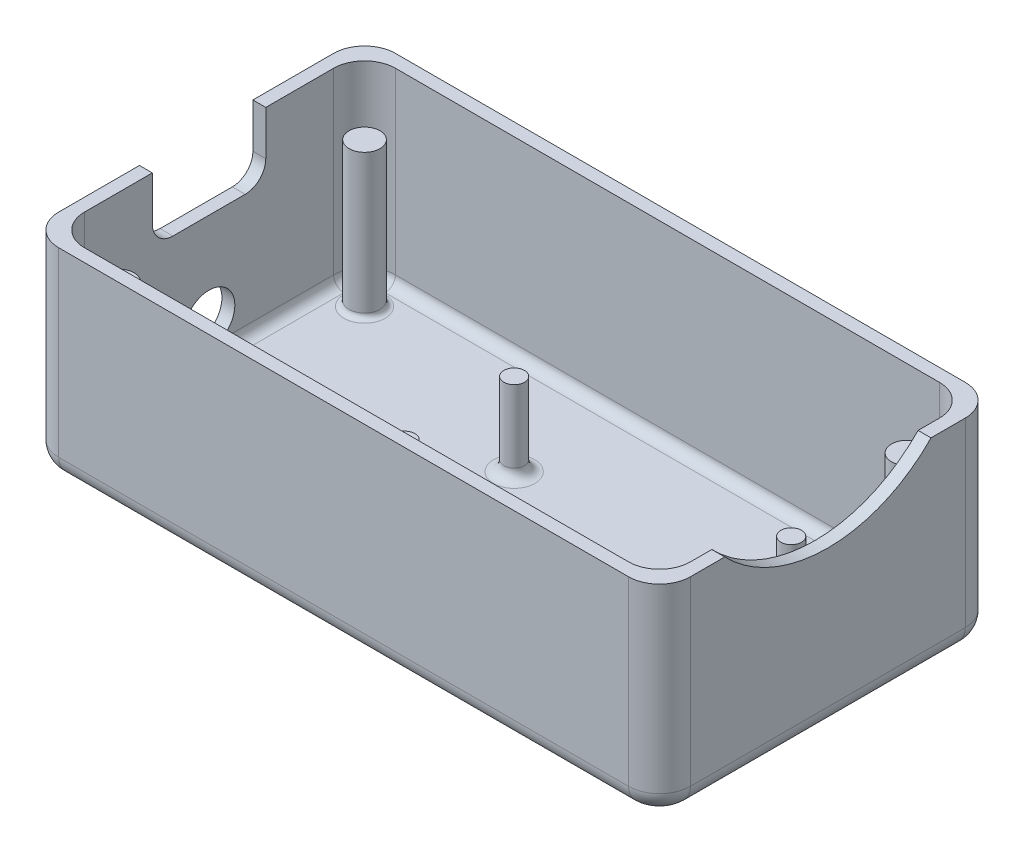
from build123d import *

# Parameters (mm, degrees)
BOSS_EXTRUDE2_DEPTH = 19.6
SKETCH3_W           = 58.75
SKETCH3_H           = 30.15
BOSS_EXTRUDE3_DEPTH = 1.25
SKETCH5_R           = 1.5
BOSS_EXTRUDE4_DEPTH = 14
FILLET1_R           = 0.5
SKETCH6_R           = 1
BOSS_EXTRUDE6_DEPTH = 8
FILLET3_R           = 1
FILLET4_R           = 2
SKETCH7_R           = 2.5
SKETCH7_W           = 11
SKETCH7_H           = 6.3
CUT_EXTRUDE1_DEPTH  = 2
FILLET7_R           = 1
CUT_EXTRUDE2_DEPTH  = 2
FILLET8_R           = 2


with BuildPart() as part:
    # Sketch2 → Boss-Extrude2 (new body)
    with BuildSketch(Plane(origin=(0, 0, 0), x_dir=(1, 0, 0), z_dir=(0, 1, 0))):
        with BuildLine():
            Line((-54.15, 1.25), (1.1, 1.25))
            ThreePointArc((1.1, 1.25), (3.221320344, 0.371320344), (4.1, -1.75))
            Line((4.1, -1.75), (4.1, -28.4))
            ThreePointArc((4.1, -28.4), (3.221320344, -30.521320344), (1.1, -31.4))
            Line((1.1, -31.4), (-54.15, -31.4))
            ThreePointArc((-54.15, -31.4), (-56.271320344, -30.521320344), (-57.15, -28.4))
            Line((-57.15, -28.4), (-57.15, -1.75))
            ThreePointArc((-57.15, -1.75), (-56.271320344, 0.371320344), (-54.15, 1.25))
        make_face()
        with BuildLine():
            Line((-52.9, -30.15), (-0.15, -30.15))
            ThreePointArc((-0.15, -30.15), (1.971320344, -29.271320344), (2.85, -27.15))
            Line((2.85, -27.15), (2.85, -3))
            ThreePointArc((2.85, -3), (1.971320344, -0.878679656), (-0.15, 0))
            Line((-0.15, 0), (-52.9, 0))
            ThreePointArc((-52.9, 0), (-55.021320344, -0.878679656), (-55.9, -3))
            Line((-55.9, -3), (-55.9, -27.15))
            ThreePointArc((-55.9, -27.15), (-55.021320344, -29.271320344), (-52.9, -30.15))
        make_face(mode=Mode.SUBTRACT)
    extrude(amount=BOSS_EXTRUDE2_DEPTH)

    # Sketch3 → Boss-Extrude3 (add)
    with BuildSketch(Plane(origin=(0, 0, 0), x_dir=(1, 0, 0), z_dir=(0, 1, 0))):
        with Locations((-26.525, -15.075)):
            Rectangle(SKETCH3_W, SKETCH3_H)
    extrude(amount=BOSS_EXTRUDE3_DEPTH)

    # Sketch5 → Boss-Extrude4 (add)
    with BuildSketch(Plane(origin=(0, 1.25, 0), x_dir=(1, 0, 0), z_dir=(0, 1, 0))):
        with Locations(Location((-52.75, -3.15, 0), (0, 0, 270))):
            Circle(SKETCH5_R)
        with Locations(Location((-0.15, -3.15, 0), (0, 0, 270))):
            Circle(SKETCH5_R)
        with Locations(Location((-0.15, -27, 0), (0, 0, 270))):
            Circle(SKETCH5_R)
        with Locations(Location((-52.75, -27, 0), (0, 0, 270))):
            Circle(SKETCH5_R)
    extrude(amount=BOSS_EXTRUDE4_DEPTH)

    # Fillet1
    fillet1_edges = [part.edges().sort_by_distance(p)[0] for p in [
        (-52.75, 1.25, 25.5),
        (-52.75, 1.25, 1.65),
        (-0.15, 1.25, 1.65),
        (-0.15, 1.25, 25.5),
    ]]
    fillet(fillet1_edges, radius=FILLET1_R)

    # Sketch6 → Boss-Extrude6 (add)
    with BuildSketch(Plane(origin=(0, 1.25, 0), x_dir=(1, 0, 0), z_dir=(0, 1, 0))):
        with Locations(Location((-31.625, -20.385, 0), (0, 0, 270))):
            Circle(SKETCH6_R)
        with Locations(Location((-31.625, -9.765, 0), (0, 0, 270))):
            Circle(SKETCH6_R)
        with Locations(Location((-4.765, -9.765, 0), (0, 0, 270))):
            Circle(SKETCH6_R)
        with Locations(Location((-4.765, -20.385, 0), (0, 0, 270))):
            Circle(SKETCH6_R)
    extrude(amount=BOSS_EXTRUDE6_DEPTH)

    # Fillet3
    fillet3_edges = [part.edges().sort_by_distance(p)[0] for p in [
        (-31.625, 1.25, 19.385),
        (-31.625, 1.25, 8.765),
        (-4.765, 1.25, 8.765),
        (-4.765, 1.25, 19.385),
    ]]
    fillet(fillet3_edges, radius=FILLET3_R)

    # Fillet4
    fillet4_edges = [part.edges().sort_by_distance(p)[0] for p in [
        (4.1, 0, 15.075),
        (3.221320344, 0, 30.521320344),
        (-26.525, 0, 31.4),
        (-56.271320344, 0, 30.521320344),
        (-57.15, 0, 15.075),
        (-56.271320344, 0, -0.371320344),
        (-26.525, 0, -1.25),
        (3.221320344, 0, -0.371320344),
    ]]
    fillet(fillet4_edges, radius=FILLET4_R)

    # Sketch7 → Cut-Extrude1 (cut)
    with BuildSketch(Plane.ZY.offset(57.15)):
        with Locations(Location((15.075, 4.5, 0), (0, 0, 270))):
            Circle(SKETCH7_R)
        with Locations((15.075, 16.45)):
            Rectangle(SKETCH7_W, SKETCH7_H)
    extrude(amount=-CUT_EXTRUDE1_DEPTH, mode=Mode.SUBTRACT)

    # Fillet7
    fillet7_edges = [part.edges().sort_by_distance(p)[0] for p in [
        (-55.9, 1.25, 15.075),
        (-55.021320344, 1.25, 29.271320344),
        (-26.525, 1.25, 30.15),
        (1.971320344, 1.25, 29.271320344),
        (2.85, 1.25, 15.075),
        (1.971320344, 1.25, 0.878679656),
        (-26.525, 1.25, 0),
        (-55.021320344, 1.25, 0.878679656),
    ]]
    fillet(fillet7_edges, radius=FILLET7_R - 0.0001)  # a hair under: the kernel refuses the full size

    # Sketch8 → Cut-Extrude2 (cut)
    with BuildSketch(Plane(origin=(4.1, 0, 0), x_dir=(0, 0, -1), z_dir=(1, 0, 0))):
        with BuildLine():
            Line((-5.075, 19.6), (-15.075, 19.6))
            Line((-15.075, 19.6), (-15.075, 15.35))
            ThreePointArc((-15.075, 15.35), (-9.642171547, 16.456580111), (-5.075, 19.6))
        make_face()
        with BuildLine():
            Line((-15.075, 15.35), (-15.075, 19.6))
            Line((-15.075, 19.6), (-25.075, 19.6))
            ThreePointArc((-25.075, 19.6), (-20.507828453, 16.456580111), (-15.075, 15.35))
        make_face()
    extrude(amount=-CUT_EXTRUDE2_DEPTH, mode=Mode.SUBTRACT)

    # Fillet8
    fillet8_edges = [part.edges().sort_by_distance(p)[0] for p in [
        (-56.525, 13.3, 20.575),
        (-56.525, 13.3, 9.575),
    ]]
    fillet(fillet8_edges, radius=FILLET8_R)


solid = part.part
